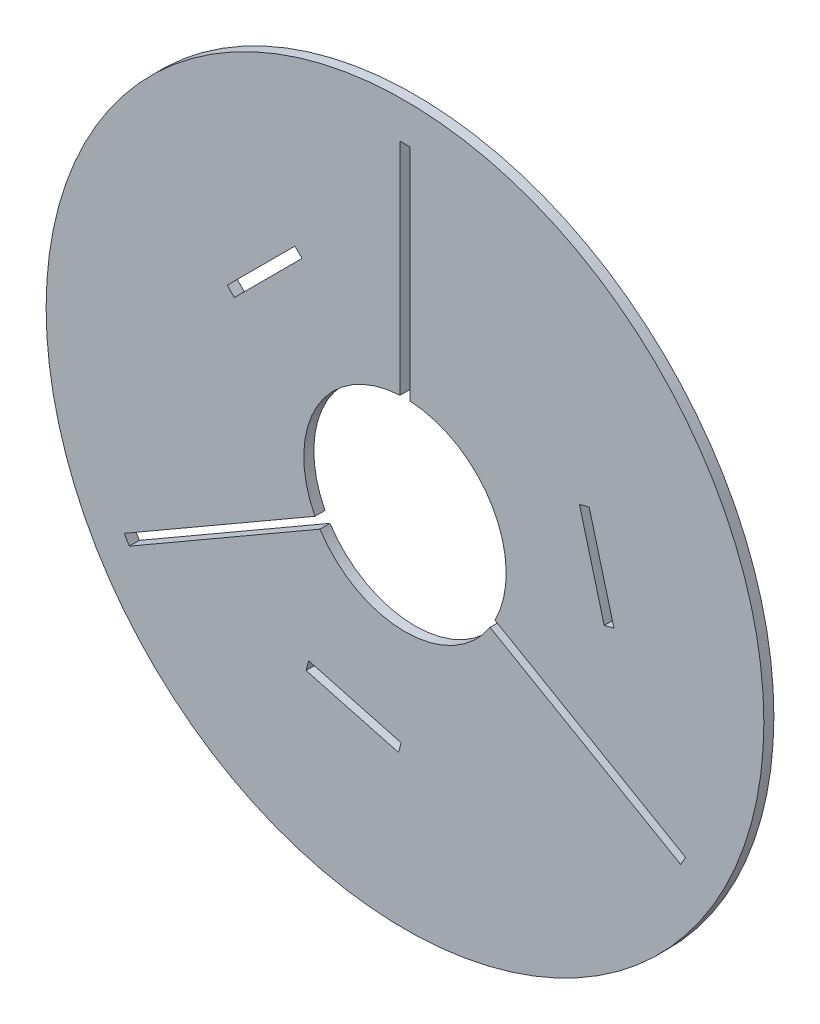
from build123d import *

# Parameters (mm, degrees)
SKETCH1_R           = 190.5
SKETCH1_R_2         = 53.721
BOSS_EXTRUDE1_DEPTH = 5.334
CUT_EXTRUDE2_REACH  = 271.46
CIRPATTERN1_COUNT   = 3
CUT_EXTRUDE3_REACH  = 271.46
CIRPATTERN2_COUNT   = 3


with BuildPart() as part:
    # Sketch1 → Boss-Extrude1 (new body)
    with BuildSketch(Plane.XY):
        Circle(SKETCH1_R)
        Circle(SKETCH1_R_2, mode=Mode.SUBTRACT)
    extrude(amount=BOSS_EXTRUDE1_DEPTH)

    # Sketch2 → Cut-Extrude2 (cut, up to next)
    with BuildSketch(Plane.XY.offset(5.334), mode=Mode.PRIVATE) as cut_extrude2_sk1:
        with BuildLine():
            Line((-2.6416, 53.656013553), (-2.6416, 170.496013553))
            Line((-2.6416, 170.496013553), (2.6416, 170.496013553))
            Line((2.6416, 170.496013553), (2.6416, 53.656013553))
            ThreePointArc((2.6416, 53.656013553), (0, 53.721), (-2.6416, 53.656013553))
        make_face()
    cut_extrude2_tool1 = extrude(cut_extrude2_sk1.sketch, amount=-CUT_EXTRUDE2_REACH, mode=Mode.PRIVATE) & part.part
    cut_extrude2 = cut_extrude2_tool1.solids().sort_by_distance((0, 112.097677, 5.334))[0]
    add(cut_extrude2, mode=Mode.SUBTRACT)

    # CirPattern1: Cut-Extrude2 ×3 about axis
    cirpattern1_axis = Axis((0, 0, 5.334), (0, 0, 1))
    for i in range(1, CIRPATTERN1_COUNT):
        add(cut_extrude2.rotate(cirpattern1_axis, i * 360 / CIRPATTERN1_COUNT), mode=Mode.SUBTRACT)

    # Sketch3 → Cut-Extrude3 (cut, up to next)
    with BuildSketch(Plane.XY.offset(5.334), mode=Mode.PRIVATE) as cut_extrude3_sk1:
        Polygon((-94.345369656, 58.424345171), (-58.424345171, 94.345369656), (-54.6526376, 90.573662085), (-90.573662085, 54.6526376), align=None)
    cut_extrude3_tool1 = extrude(cut_extrude3_sk1.sketch, amount=-CUT_EXTRUDE3_REACH, mode=Mode.PRIVATE) & part.part
    cut_extrude3 = cut_extrude3_tool1.solids().sort_by_distance((-74.499004, 74.499004, 5.334))[0]
    add(cut_extrude3, mode=Mode.SUBTRACT)

    # CirPattern2: Cut-Extrude3 ×3 about axis
    cirpattern2_axis = Axis((0, 0, 5.334), (0, 0, 1))
    for i in range(1, CIRPATTERN2_COUNT):
        add(cut_extrude3.rotate(cirpattern2_axis, i * 360 / CIRPATTERN2_COUNT), mode=Mode.SUBTRACT)


solid = part.part
